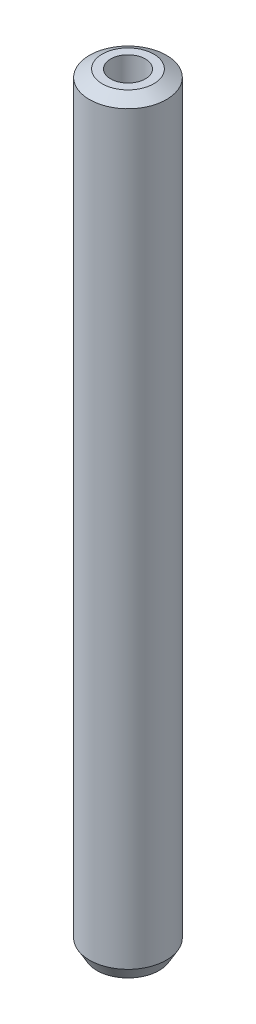
from build123d import *
from OCP.BRepFilletAPI import BRepFilletAPI_MakeChamfer

# Parameters (mm, degrees)
SKETCH1_R           = 10
BOSS_EXTRUDE1_DEPTH = 199.033229491
SKETCH2_R           = 4.507535536
CUT_EXTRUDE1_DEPTH  = 200.535025601
CHAMFER1_SIZE       = 1.90638963
CHAMFER1_SIZE2      = 3.301963698


with BuildPart() as part:
    # Sketch1 → Boss-Extrude1 (new body)
    with BuildSketch(Plane(origin=(0, 0, 0), x_dir=(1, 0, 0), z_dir=(0, 1, 0))):
        Circle(SKETCH1_R)
    extrude(amount=BOSS_EXTRUDE1_DEPTH)

    # Sketch2 → Cut-Extrude1 (cut, through all)
    with BuildSketch(Plane(origin=(0, 0, 0), x_dir=(1, 0, 0), z_dir=(0, 1, 0))):
        Circle(SKETCH2_R)
    extrude(amount=CUT_EXTRUDE1_DEPTH, mode=Mode.SUBTRACT)

    # Chamfer1: one chamfer whose edges measure the first distance from different faces: ONE call of the kernel's chamfer builder (chamfer() names one face for all edges)
    chamfer1_edges_1 = [part.edges().sort_by_distance(p)[0] for p in [
        (-10, 199.033229491, 0),
    ]]
    chamfer1_side_1 = [part.faces().sort_by_distance(p)[0] for p in [
        (-10, 99.516614745, 0),
    ]]
    chamfer1_edges_2 = [part.edges().sort_by_distance(p)[0] for p in [
        (-10, 0, 0),
    ]]
    chamfer1_side_2 = [part.faces().sort_by_distance(p)[0] for p in [
        (-9.717157288, 0, 0),
    ]]
    chamfer1 = BRepFilletAPI_MakeChamfer(part.part.solid().wrapped)
    for e in chamfer1_edges_1:
        chamfer1.Add(CHAMFER1_SIZE, CHAMFER1_SIZE2, e.wrapped, chamfer1_side_1[0].wrapped)  # the first distance lies on this face
    for e in chamfer1_edges_2:
        chamfer1.Add(CHAMFER1_SIZE, CHAMFER1_SIZE2, e.wrapped, chamfer1_side_2[0].wrapped)  # the first distance lies on this face
    add(Compound.cast(chamfer1.Shape()), mode=Mode.REPLACE)


solid = part.part
